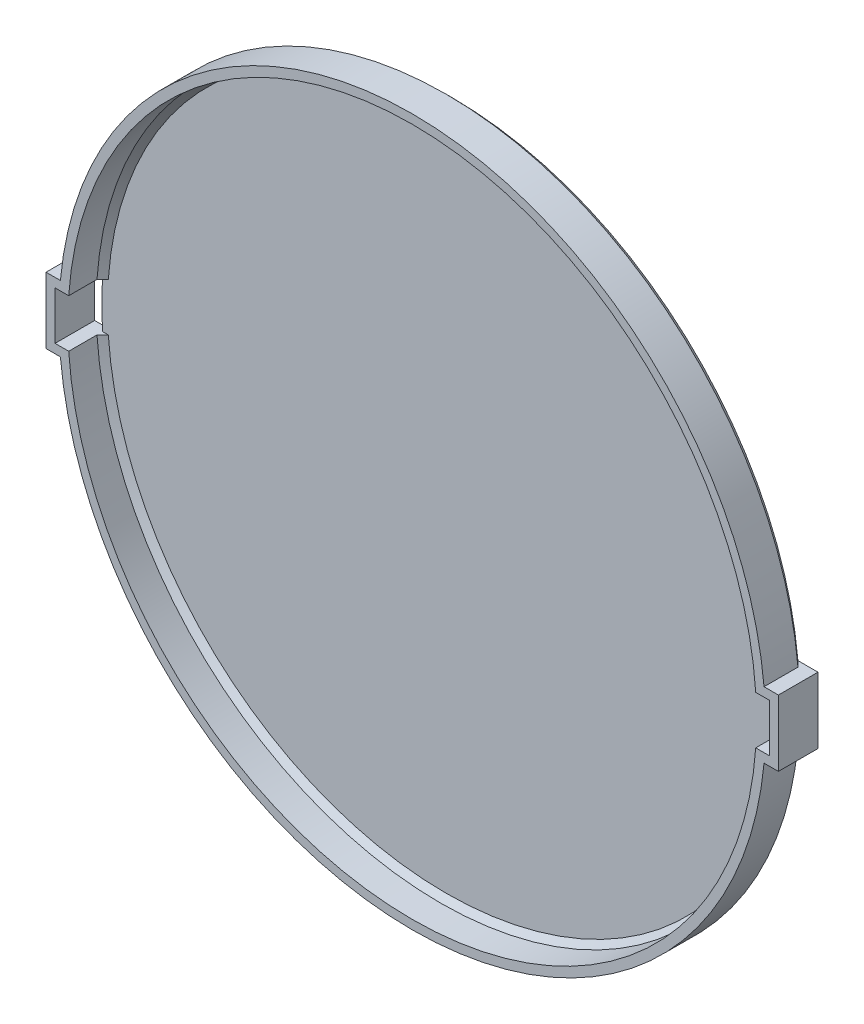
from build123d import *

# Parameters (mm, degrees)
BOSS_EXTRUDE1_DEPTH = 6
BOSS_EXTRUDE2_START = -1
SKETCH1_2_R         = 62.5
BOSS_EXTRUDE2_DEPTH = 1
CUT_EXTRUDE1_DEPTH  = 89.591760339
BOSS_EXTRUDE3_START = -1
BOSS_EXTRUDE3_DEPTH = 7
CHAMFER1_SIZE       = 1


with BuildPart() as part:
    # Sketch1 → Boss-Extrude1 (new body)
    with BuildSketch(Plane.XY):
        with BuildLine():
            ThreePointArc((-60.751522615, -4.25), (-60.9, 0), (-60.751522615, 4.25))
            Line((-60.751522615, 4.25), (-62.355332571, 4.25))
            ThreePointArc((-62.355332571, 4.25), (-62.5, 0), (-62.355332571, -4.25))
            Line((-62.355332571, -4.25), (-60.751522615, -4.25))
        make_face()
        with BuildLine():
            Line((-62.355332571, 4.25), (-60.751522615, 4.25))
            ThreePointArc((-60.751522615, 4.25), (2.126296401, 60.862869334), (60.9, 0))
            ThreePointArc((60.9, 0), (2.126296401, -60.862869334), (-60.751522615, -4.25))
            Line((-60.751522615, -4.25), (-62.355332571, -4.25))
            ThreePointArc((-62.355332571, -4.25), (-62.295612153, -5.050416467), (-62.225617715, -5.85))
            ThreePointArc((-62.225617715, -5.85), (2.928215567, -62.431366745), (62.5, 0))
            ThreePointArc((62.5, 0), (2.928215567, 62.431366745), (-62.225617715, 5.85))
            ThreePointArc((-62.225617715, 5.85), (-62.295612153, 5.050416467), (-62.355332571, 4.25))
        make_face()
    extrude(amount=BOSS_EXTRUDE1_DEPTH)

    # Sketch1<2> → Boss-Extrude2 (add)
    with BuildSketch(Plane.XY.offset(BOSS_EXTRUDE2_START)):
        Circle(SKETCH1_2_R)
    extrude(amount=BOSS_EXTRUDE2_DEPTH)

    # Sketch1<4> → Cut-Extrude1 (cut, symmetric)
    with BuildSketch(Plane.XY):
        with BuildLine():
            ThreePointArc((-60.751522615, -4.25), (-60.9, 0), (-60.751522615, 4.25))
            Line((-60.751522615, 4.25), (-62.355332571, 4.25))
            ThreePointArc((-62.355332571, 4.25), (-62.5, 0), (-62.355332571, -4.25))
            Line((-62.355332571, -4.25), (-60.751522615, -4.25))
        make_face()
    cut_extrude1 = extrude(amount=CUT_EXTRUDE1_DEPTH, both=True, mode=Mode.SUBTRACT)

    # Sketch1<5> → Boss-Extrude3 (add)
    with BuildSketch(Plane.XY.offset(BOSS_EXTRUDE3_START)):
        with BuildLine():
            Line((-63.1627417, 4.25), (-62.355332571, 4.25))
            ThreePointArc((-62.355332571, 4.25), (-62.295612153, 5.050416467), (-62.225617715, 5.85))
            Line((-62.225617715, 5.85), (-64.7627417, 5.85))
            Line((-64.7627417, 5.85), (-64.7627417, -5.85))
            Line((-64.7627417, -5.85), (-62.225617715, -5.85))
            ThreePointArc((-62.225617715, -5.85), (-62.295612153, -5.050416467), (-62.355332571, -4.25))
            Line((-62.355332571, -4.25), (-63.1627417, -4.25))
            Line((-63.1627417, -4.25), (-63.1627417, 4.25))
        make_face()
    boss_extrude3 = extrude(amount=BOSS_EXTRUDE3_DEPTH)

    # Mirror1: Cut-Extrude1, Boss-Extrude3 across plane
    add(cut_extrude1.mirror(Plane(origin=(0, 0, 0), x_dir=(0, 0, 1), z_dir=(1, 0, 0))), mode=Mode.SUBTRACT)
    add(boss_extrude3.mirror(Plane(origin=(0, 0, 0), x_dir=(0, 0, 1), z_dir=(1, 0, 0))))

    # Chamfer1
    chamfer1_edges = [part.edges().sort_by_distance(p)[0] for p in [
        (0, -60.9, 0),
        (0, -62.5, -1),
        (0, 60.9, 0),
        (0, 62.5, -1),
    ]]
    chamfer(chamfer1_edges, length=CHAMFER1_SIZE - 0.0001)  # a hair under: the kernel refuses the full size


solid = part.part
